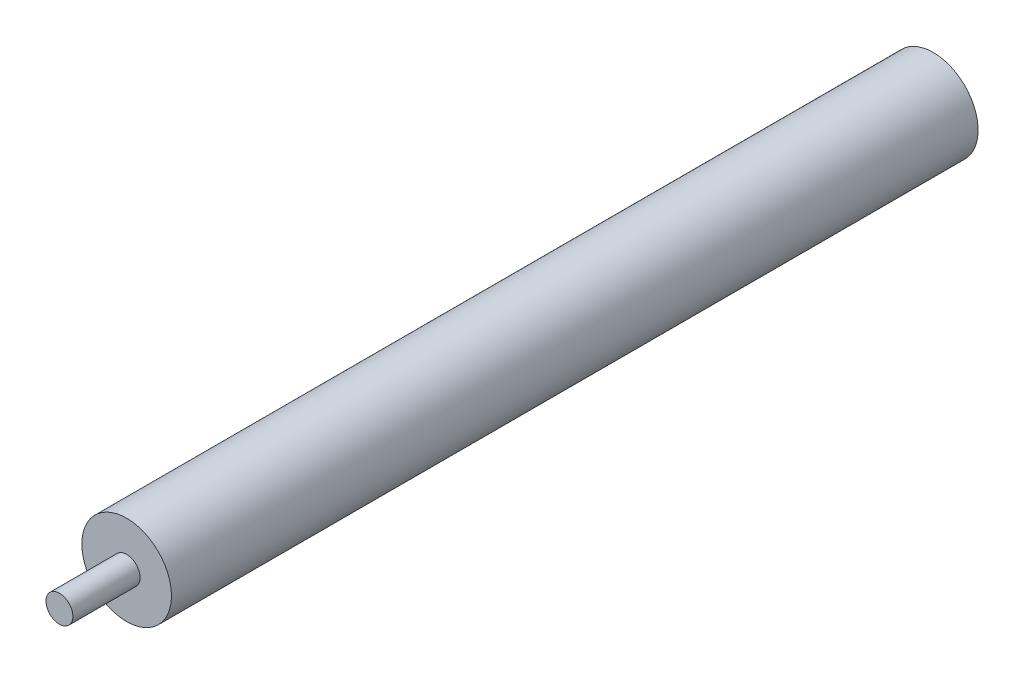
from build123d import *

# Parameters (mm, degrees)
SKETCH1_R           = 10
BOSS_EXTRUDE1_DEPTH = 180
SKETCH2_R           = 3
BOSS_EXTRUDE2_DEPTH = 15


with BuildPart() as part:
    # Sketch1 → Boss-Extrude1 (new body)
    with BuildSketch(Plane.XY):
        Circle(SKETCH1_R)
    extrude(amount=BOSS_EXTRUDE1_DEPTH)

    # Sketch2 → Boss-Extrude2 (add)
    with BuildSketch(Plane.XY.offset(180)):
        Circle(SKETCH2_R)
    extrude(amount=BOSS_EXTRUDE2_DEPTH)


solid = part.part
